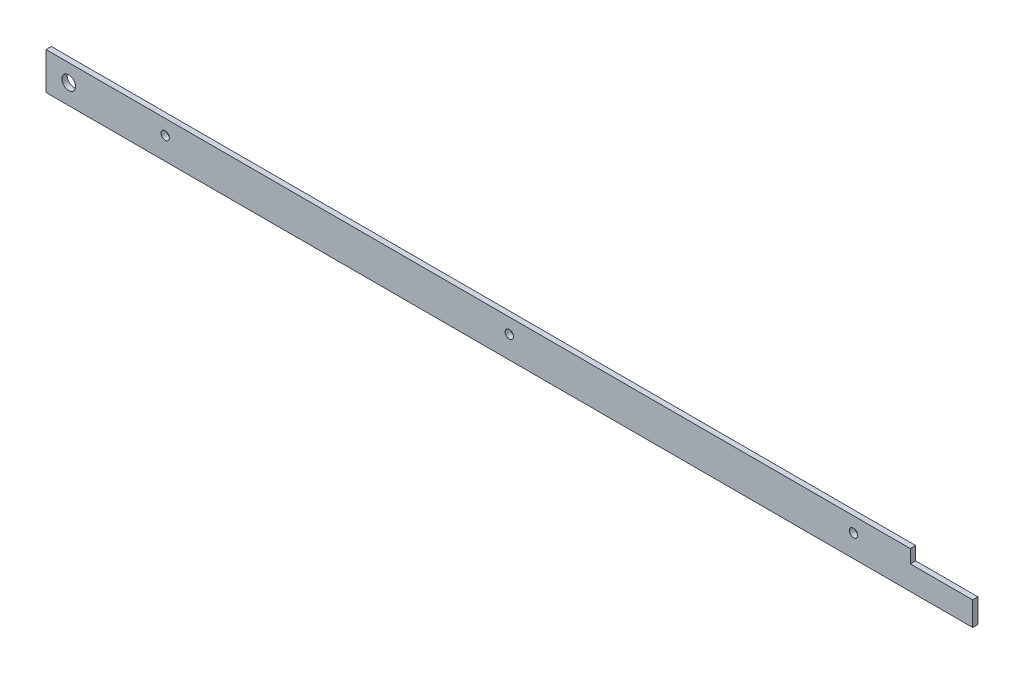
from build123d import *

# Parameters (mm, degrees)
SKETCH1_R           = 4.0635
SKETCH1_R_2         = 2.4892
BOSS_EXTRUDE1_DEPTH = 3.175


with BuildPart() as part:
    # Sketch1 → Boss-Extrude1 (new body)
    with BuildSketch(Plane.XY):
        Polygon((0, 17.391988029), (0, -4.833011971), (553.1, -4.833011971), (553.1, 9.446988029), (515.860000058, 9.446988029), (515.860000058, 17.391988029), align=None)
        with Locations((13.54, 7.026988029)):
            Circle(SKETCH1_R, mode=Mode.SUBTRACT)
        with Locations((71.12, 8.509488029)):
            Circle(SKETCH1_R_2, mode=Mode.SUBTRACT)
        with Locations((276.55, 8.509488029)):
            Circle(SKETCH1_R_2, mode=Mode.SUBTRACT)
        with Locations((481.98, 8.509488029)):
            Circle(SKETCH1_R_2, mode=Mode.SUBTRACT)
    extrude(amount=BOSS_EXTRUDE1_DEPTH)


solid = part.part
